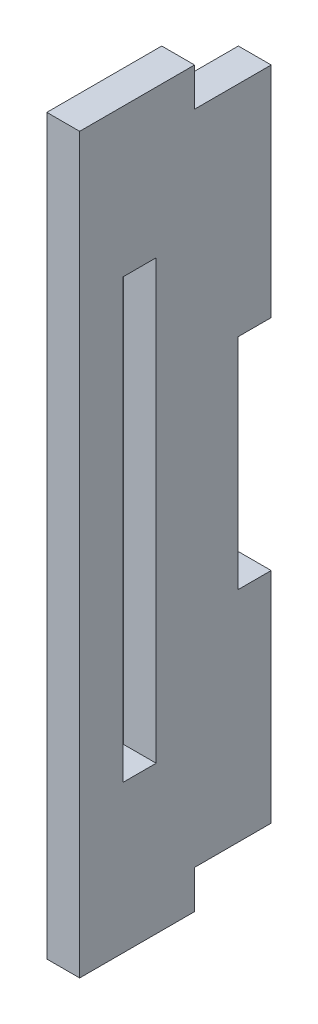
from build123d import *

# Parameters (mm, degrees)
CROQUIS1_W              = 35
CROQUIS1_H              = 120
SALIENTE_EXTRUIR1_DEPTH = 6
CROQUIS3_W              = 6.02
CROQUIS3_H              = 40.02
CORTAR_EXTRUIR1_DEPTH   = 126.143917151
CROQUIS4_W              = 6.05
CROQUIS4_H              = 80
CORTAR_EXTRUIR2_DEPTH   = 10
CROQUIS5_W              = 21
CROQUIS5_H              = 7
SALIENTE_EXTRUIR2_DEPTH = 6


with BuildPart() as part:
    # Croquis1 → Saliente-Extruir1 (new body)
    with BuildSketch(Plane(origin=(0, 0, 0), x_dir=(0, 0, -1), z_dir=(1, 0, 0))):
        with Locations((17.5, 60)):
            Rectangle(CROQUIS1_W, CROQUIS1_H)
    extrude(amount=SALIENTE_EXTRUIR1_DEPTH)

    # Croquis3 → Cortar-Extruir1 (cut, through all)
    with BuildSketch(Plane(origin=(0, 0, 0), x_dir=(0, 0, -1), z_dir=(1, 0, 0))):
        with Locations((31.99, 60)):
            Rectangle(CROQUIS3_W, CROQUIS3_H)
    extrude(amount=CORTAR_EXTRUIR1_DEPTH, mode=Mode.SUBTRACT)

    # Croquis4 → Cortar-Extruir2 (cut)
    with BuildSketch(Plane(origin=(0, 0, 0), x_dir=(0, 0, -1), z_dir=(1, 0, 0))):
        with Locations((10.955, 60)):
            Rectangle(CROQUIS4_W, CROQUIS4_H)
    extrude(amount=CORTAR_EXTRUIR2_DEPTH, mode=Mode.SUBTRACT)

    # Croquis5 → Saliente-Extruir2 (add)
    with BuildSketch(Plane(origin=(0, 0, 0), x_dir=(0, 0, -1), z_dir=(1, 0, 0))):
        with Locations((10.5, 123.5)):
            Rectangle(CROQUIS5_W, CROQUIS5_H)
        with Locations((10.5, -3.5)):
            Rectangle(CROQUIS5_W, CROQUIS5_H)
    extrude(amount=SALIENTE_EXTRUIR2_DEPTH)


solid = part.part
